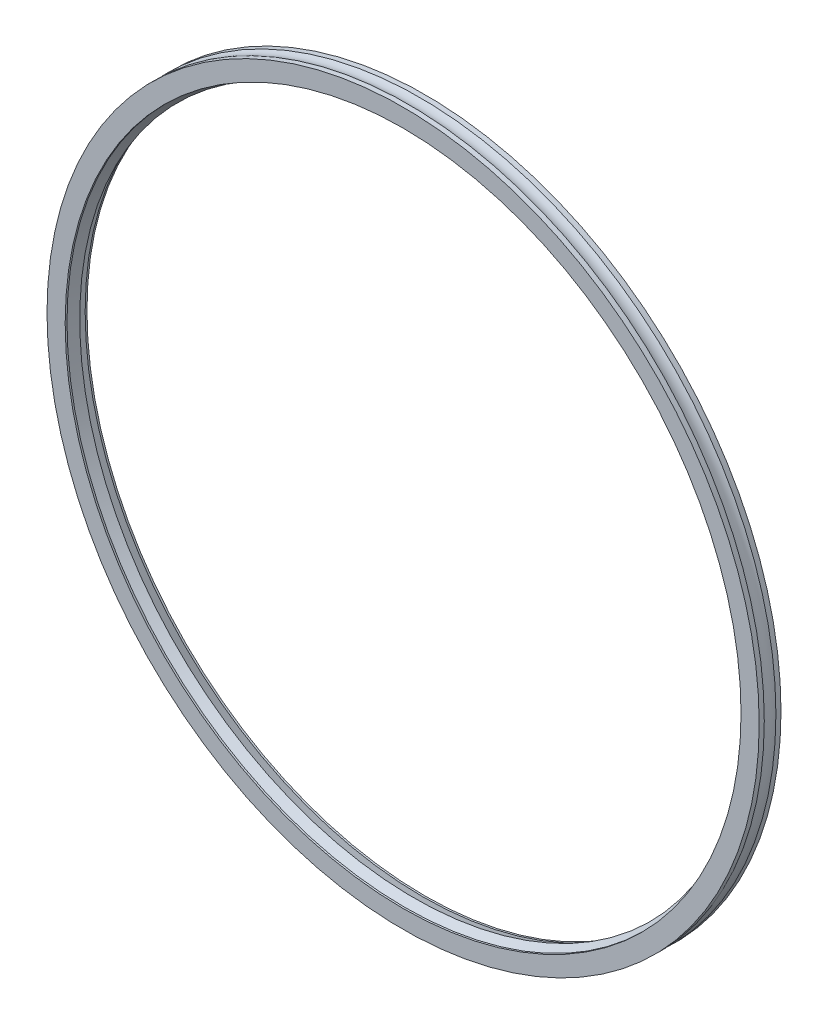
from build123d import *


with BuildPart() as part:
    # Sketch1 → Revolve1 (revolve)
    with BuildSketch(Plane(origin=(0, 0, 0), x_dir=(0, 0, -1), z_dir=(1, 0, 0))):
        with BuildLine():
            Line((0.8, 49), (1.5, 49))
            Line((1.5, 49), (1.5, 46.5))
            Line((1.5, 46.5), (1.25, 46.5))
            Line((1.25, 46.5), (0, 46))
            Line((0, 46), (-1.25, 46.5))
            Line((-1.25, 46.5), (-1.5, 46.5))
            Line((-1.5, 46.5), (-1.5, 49))
            Line((-1.5, 49), (-0.8, 49))
            ThreePointArc((-0.8, 49), (0, 48.833030278), (0.8, 49))
        make_face()
    revolve(axis=Axis((0, 0, 0), (0, 0, -1)))


solid = part.part
